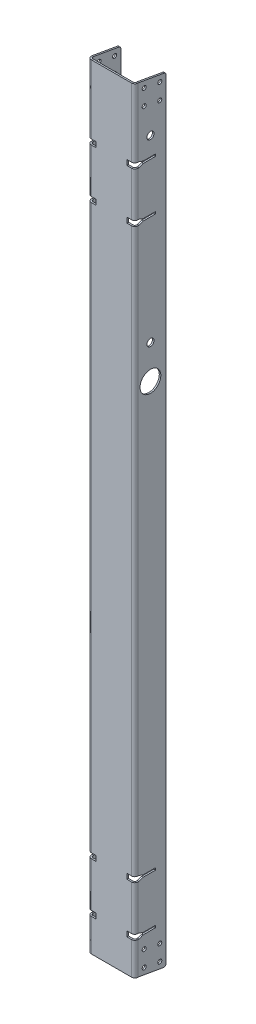
from build123d import *

# Parameters (mm, degrees)
SKETCH1_W                        = 57.15
SKETCH1_H                        = 946.658
BASE_FLANGE1_DEPTH               = 1.89738
EDGE_FLANGE1_STRIP_W             = 11.65352
EDGE_FLANGE1_STRIP_H             = 1.89738
EDGE_FLANGE1_STRIP_CUT_DEPTH     = 946.658
EDGE_FLANGE1_DEPTH               = 946.658
EDGE_FLANGE1_FLAT_DEPTH          = 1.89738
EDGE_FLANGE2_STRIP_W             = 11.65352
EDGE_FLANGE2_STRIP_H             = 1.89738
EDGE_FLANGE2_STRIP_CUT_DEPTH     = 946.658
EDGE_FLANGE2_DEPTH               = 946.658
EDGE_FLANGE2_FLAT_DEPTH          = 1.89738
FILLET1_R                        = 2.54
SKETCH12_R                       = 2.4638
CUT_EXTRUDE1_DEPTH               = 484.620370701
SKETCH13_R                       = 2.4638
CUT_EXTRUDE2_DEPTH               = 484.620370701
CUT_EXTRUDE3_DEPTH               = 9.525
LPATTERN1_COUNT                  = 2
LPATTERN1_PITCH                  = 755.65
MIRROR1_COPY_1_DEPTH             = 9.525
SKETCH15_R                       = 12.7
CUT_EXTRUDE4_DEPTH               = 484.620370701
F_11_32_0_34375_DIAMETER_HOLE1_D = 8.73125


# Sheet-metal steps are written as plain solids
with BuildPart() as part:
    # Sketch1 → Base-Flange1 (new body)
    with BuildSketch(Plane.XY):
        Rectangle(SKETCH1_W, SKETCH1_H)
    extrude(amount=-BASE_FLANGE1_DEPTH)

    # Edge-Flange1 strip (across the edge) → Edge-Flange1 strip cut (cut)
    with BuildSketch(Plane(origin=(28.575, 473.329, -1.89738), x_dir=(-1, 0, 0), z_dir=(0, -1, 0))):
        with Locations((-1.89738, -0.94869)):
            Rectangle(EDGE_FLANGE1_STRIP_W, EDGE_FLANGE1_STRIP_H)
    extrude(amount=EDGE_FLANGE1_STRIP_CUT_DEPTH, mode=Mode.SUBTRACT)

    # Edge-Flange1 bend section (across the edge) → Edge-Flange1 (add)
    with BuildSketch(Plane(origin=(28.575, 473.329, -1.89738), x_dir=(-1, 0, 0), z_dir=(0, -1, 0))):
        with BuildLine():
            Line((0, 2.032), (1.89738, 2.032))
            ThreePointArc((1.89738, 2.032), (2.492539021, 0.595159021), (3.92938, 0))
            Line((3.92938, 0), (3.92938, -1.89738))
            ThreePointArc((3.92938, -1.89738), (1.150888756, -0.746491244), (0, 2.032))
        make_face()
    extrude(amount=EDGE_FLANGE1_DEPTH)

    # Edge-Flange1 profile (on flange) → Edge-Flange1 flat (add)
    with BuildSketch(Plane(origin=(28.575, 0, -1.89738), x_dir=(0, 1, 0), z_dir=(-1, 0, 0))):
        Polygon((473.329, 2.032), (473.329, 2.87782), (467.452938633, 36.20262), (-479.205061367, 36.20262), (-473.329, 2.87782), (-473.329, 2.032), align=None)
    extrude(amount=EDGE_FLANGE1_FLAT_DEPTH)

    # Edge-Flange2 strip (across the edge) → Edge-Flange2 strip cut (cut)
    with BuildSketch(Plane(origin=(-28.575, -473.329, -1.89738), x_dir=(1, 0, 0), z_dir=(0, 1, 0))):
        with Locations((-1.89738, -0.94869)):
            Rectangle(EDGE_FLANGE2_STRIP_W, EDGE_FLANGE2_STRIP_H)
    extrude(amount=EDGE_FLANGE2_STRIP_CUT_DEPTH, mode=Mode.SUBTRACT)

    # Edge-Flange2 bend section (across the edge) → Edge-Flange2 (add)
    with BuildSketch(Plane(origin=(-28.575, -473.329, -1.89738), x_dir=(1, 0, 0), z_dir=(0, 1, 0))):
        with BuildLine():
            Line((0, 2.032), (1.89738, 2.032))
            ThreePointArc((1.89738, 2.032), (2.492539021, 0.595159021), (3.92938, 0))
            Line((3.92938, 0), (3.92938, -1.89738))
            ThreePointArc((3.92938, -1.89738), (1.150888756, -0.746491244), (0, 2.032))
        make_face()
    extrude(amount=EDGE_FLANGE2_DEPTH)

    # Edge-Flange2 profile (on flange) → Edge-Flange2 flat (add)
    with BuildSketch(Plane(origin=(-28.575, 0, -1.89738), x_dir=(0, -1, 0), z_dir=(1, 0, 0))):
        Polygon((-473.329, 2.87782), (-473.329, 2.032), (473.329, 2.032), (473.329, 2.87782), (479.205061367, 36.20262), (-467.452938633, 36.20262), align=None)
    extrude(amount=EDGE_FLANGE2_FLAT_DEPTH)

    # Fillet1
    fillet1_edges = [part.edges().sort_by_distance(p)[0] for p in [
        (27.62631, -479.205061367, -38.1),
        (27.62631, 467.452938633, -38.1),
        (-27.62631, 467.452938633, -38.1),
        (-27.62631, -479.205061367, -38.1),
    ]]
    fillet(fillet1_edges, radius=FILLET1_R)

    # Sketch12 → Cut-Extrude1 (cut, through all)
    with BuildSketch(Plane.ZY.offset(28.575)):
        with Locations((-30.48, -470.123898991)):
            Circle(SKETCH12_R)
        with Locations((-30.48, -450.780022035)):
            Circle(SKETCH12_R)
        with Locations((-11.43, -447.420993052)):
            Circle(SKETCH12_R)
        with Locations((-11.43, -466.764870009)):
            Circle(SKETCH12_R)
    extrude(amount=-CUT_EXTRUDE1_DEPTH, mode=Mode.SUBTRACT)

    # Sketch13 → Cut-Extrude2 (cut, through all)
    with BuildSketch(Plane.ZY.offset(28.575)):
        with Locations((-30.48, 461.058999444)):
            Circle(SKETCH13_R)
        with Locations((-11.43, 464.418028426)):
            Circle(SKETCH13_R)
        with Locations((-11.43, 445.07415147)):
            Circle(SKETCH13_R)
        with Locations((-30.48, 441.715122487)):
            Circle(SKETCH13_R)
    extrude(amount=-CUT_EXTRUDE2_DEPTH, mode=Mode.SUBTRACT)

    # Sketch14 → Cut-Extrude3 (cut)
    with BuildSketch(Plane.ZY.offset(28.575)):
        Polygon((3.175, 389.509), (3.175, 383.159), (-5.08, 383.159), (-10.16, 385.064), (-25.4, 385.064), (-25.4, 387.604), (-10.16, 387.604), (-5.08, 389.509), align=None)
        Polygon((3.175, 328.549), (3.175, 322.199), (-5.08, 322.199), (-10.16, 324.104), (-25.4, 324.104), (-25.4, 326.644), (-10.16, 326.644), (-5.08, 328.549), align=None)
    cut_extrude3 = extrude(amount=-CUT_EXTRUDE3_DEPTH, mode=Mode.SUBTRACT)

    # LPattern1: Cut-Extrude3 ×2
    with Locations(*[(0, -i * LPATTERN1_PITCH, 0) for i in range(1, LPATTERN1_COUNT)]):
        add(cut_extrude3, mode=Mode.SUBTRACT)

    # Mirror1: Cut-Extrude3 across plane
    add(cut_extrude3.mirror(Plane(origin=(0, 0, 0), x_dir=(0, 0, 1), z_dir=(1, 0, 0))), mode=Mode.SUBTRACT)

    # Mirror1 copy 1 sketch → Mirror1 copy 1 (cut)
    with BuildSketch(Plane(origin=(28.575, -755.65, 0), x_dir=(0, 0, 1), z_dir=(1, 0, 0))):
        Polygon((3.175, -389.509), (3.175, -383.159), (-5.08, -383.159), (-10.16, -385.064), (-25.4, -385.064), (-25.4, -387.604), (-10.16, -387.604), (-5.08, -389.509), align=None)
        Polygon((3.175, -328.549), (3.175, -322.199), (-5.08, -322.199), (-10.16, -324.104), (-25.4, -324.104), (-25.4, -326.644), (-10.16, -326.644), (-5.08, -328.549), align=None)
    extrude(amount=-MIRROR1_COPY_1_DEPTH, mode=Mode.SUBTRACT)

    # Sketch15 → Cut-Extrude4 (cut, through all)
    with BuildSketch(Plane.ZY.offset(28.575)):
        with Locations((-19.05, 149.961528499)):
            Circle(SKETCH15_R)
    extrude(amount=-CUT_EXTRUDE4_DEPTH, mode=Mode.SUBTRACT)

    # 11/32 (0.34375) Diameter Hole1 (through all)
    with Locations(Plane.ZY.offset(28.575)):
        with Locations((-19.05, 410.201153152), (-19.05, 191.126153152)):
            Hole(F_11_32_0_34375_DIAMETER_HOLE1_D / 2)


solid = part.part
